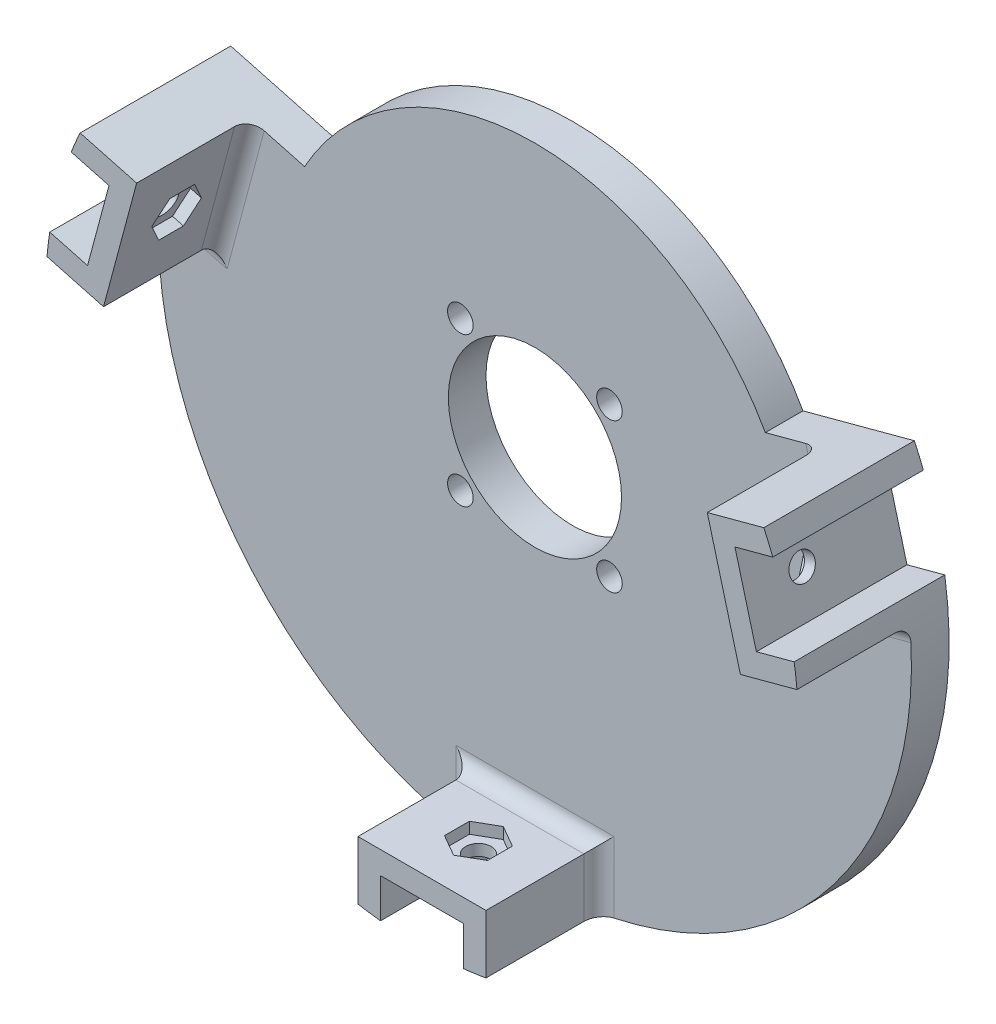
from build123d import *

# Parameters (mm, degrees)
CUT_EXTRUDE_1_DEPTH         = 1013.4351831105043
EXTRUDE_START               = 14.999999999999998
EXTRUDE_1_DEPTH             = 14.999999999999998
CUT_EXTRUDE_2_DEPTH         = 1008.5341185289956
EXTRUDE_2_DEPTH             = 14.999999999999998
CUT_EXTRUDE_3_DEPTH         = 1008.5341185289956
EXTRUDE_3_DEPTH             = 14.999999999999998
CUT_EXTRUDE_4_DEPTH         = 1008.5341185289956
CUT_EXTRUDE_5_DEPTH         = 1.5000000000000013
CUT_EXTRUDE_6_DEPTH         = 1.500000000000375
CUT_EXTRUDE_7_DEPTH         = 1.500000000000482
HOLE_WIZARD_23_0_23_1_D     = 23
HOLE_WIZARD_23_0_23_1_DEPTH = 20
HOLE_WIZARD_3_4_3_4_1_D     = 3.4
HOLE_WIZARD_3_4_3_4_1_DEPTH = 20
HOLE_WIZARD_3_4_3_4_2_D     = 3.4
HOLE_WIZARD_3_4_3_4_2_DEPTH = 6.696579359
HOLE_WIZARD_3_4_3_4_3_D     = 3.4
HOLE_WIZARD_3_4_3_4_3_DEPTH = 14.354957893
HOLE_WIZARD_3_4_3_4_4_D     = 3.4
HOLE_WIZARD_3_4_3_4_4_DEPTH = 14.354957893
FILLET_1_R                  = 2


with BuildPart() as part:
    # 草图1 → 旋转1 (revolve)
    with BuildSketch(Plane.XZ.offset(-300), mode=Mode.PRIVATE) as revolve_1_sk:
        Polygon((950.0000000000001, 5), (900, 4.999999999999999), (900, 0), (950.0000000000001, 0), align=None)
    revolve(revolve_1_sk.sketch.rotate(Axis((900, 300, 4.999999999999999), (0, 0, -1)), 180), axis=Axis((900, 300, 4.999999999999999), (0, 0, -1)))

    # 草图2 → 切除-拉伸1 (cut, through all)
    with BuildSketch(Plane.XY.offset(4.999999999999999)):
        with BuildLine():
            Line((854.6066683745289, 320.9629540842885), (869.404681855504, 316.99783832247647))
            ThreePointArc((869.404681855504, 316.99783832247647), (900, 334.99999999999966), (930.5953181444959, 316.99783832247647))
            Line((930.5953181444959, 316.99783832247647), (945.393331625471, 320.9629540842885))
            ThreePointArc((945.393331625471, 320.9629540842885), (900, 349.9999999999997), (854.6066683745289, 320.9629540842885))
        make_face()
    extrude(amount=-CUT_EXTRUDE_1_DEPTH, mode=Mode.SUBTRACT)

    # 草图3 → 凸台-拉伸1 (add)
    with BuildSketch(Plane.XY.offset(4.999999999999999).offset(EXTRUDE_START)):
        with BuildLine():
            Line((854.6066683745289, 320.9629540842885), (862.114040092375, 318.9513598952115))
            Line((862.114040092375, 318.9513598952115), (857.7141163256321, 302.5306208482976))
            Line((857.7141163256321, 302.5306208482976), (850.206744607786, 304.5422150373745))
            ThreePointArc((850.206744607786, 304.5422150373745), (851.7037086855465, 312.9409522551258), (854.6066683745289, 320.9629540842885))
        make_face()
    extrude(amount=-EXTRUDE_1_DEPTH)

    # 草图4 → 切除-拉伸2 (cut, through all)
    with BuildSketch(Plane.XY.offset(19.999999999999996)):
        with BuildLine():
            Line((850.573285770712, 307.549829170006), (855.592795982073, 306.204855462472))
            Line((855.592795982073, 306.204855462472), (858.4398054782009, 316.830039551652))
            Line((858.4398054782009, 316.830039551652), (853.4202952668401, 318.175013259186))
            ThreePointArc((853.4202952668401, 318.175013259186), (851.7037086855471, 312.9409522551259), (850.573285770712, 307.549829170006))
        make_face()
    extrude(amount=-CUT_EXTRUDE_2_DEPTH, mode=Mode.SUBTRACT)

    # 草图5 → 凸台-拉伸2 (add)
    with BuildSketch(Plane.XY.offset(4.999999999999999).offset(EXTRUDE_START)):
        with BuildLine():
            Line((891.5, 250.7277968830295), (891.5, 258.5))
            Line((891.5, 258.5), (908.5, 258.5))
            Line((908.5, 258.5), (908.5, 250.7277968830295))
            ThreePointArc((908.5, 250.7277968830295), (900, 250.00000000000003), (891.5, 250.7277968830295))
        make_face()
    extrude(amount=-EXTRUDE_2_DEPTH)

    # 草图6 → 切除-拉伸3 (cut, through all)
    with BuildSketch(Plane.XY.offset(19.999999999999996)):
        with BuildLine():
            Line((905.5, 250.30342064085298), (905.5, 255.5))
            Line((905.5, 255.5), (894.5, 255.5))
            Line((894.5, 255.5), (894.5, 250.30342064085298))
            ThreePointArc((894.5, 250.30342064085298), (900, 250.00000000000003), (905.5, 250.30342064085298))
        make_face()
    extrude(amount=-CUT_EXTRUDE_3_DEPTH, mode=Mode.SUBTRACT)

    # 草图7 → 凸台-拉伸3 (add)
    with BuildSketch(Plane.XY.offset(4.999999999999999).offset(EXTRUDE_START)):
        with BuildLine():
            Line((949.7932553922141, 304.5422150373745), (942.285883674368, 302.5306208482975))
            Line((942.285883674368, 302.5306208482975), (937.885959907625, 318.9513598952115))
            Line((937.885959907625, 318.9513598952115), (945.393331625471, 320.9629540842885))
            ThreePointArc((945.393331625471, 320.9629540842885), (948.2962913144532, 312.94095225512575), (949.7932553922141, 304.5422150373745))
        make_face()
    extrude(amount=-EXTRUDE_3_DEPTH)

    # 草图8 → 切除-拉伸4 (cut, through all)
    with BuildSketch(Plane.XY.offset(19.999999999999996)):
        with BuildLine():
            Line((946.5797047331605, 318.17501325918545), (941.5601945218003, 316.83003955165213))
            Line((941.5601945218003, 316.83003955165213), (944.4072040179273, 306.20485546247204))
            Line((944.4072040179273, 306.20485546247204), (949.4267142292881, 307.5498291700056))
            ThreePointArc((949.4267142292881, 307.5498291700056), (948.2962913144534, 312.94095225512547), (946.5797047331605, 318.17501325918545))
        make_face()
    extrude(amount=-CUT_EXTRUDE_4_DEPTH, mode=Mode.SUBTRACT)

    # 草图9 → 切除-拉伸5 (cut)
    with BuildSketch(Plane(origin=(0, 258.5, 0), x_dir=(-1, 0, 0), z_dir=(0, 1, 0))):
        Polygon((-902.857883832489, 14.149999999999999), (-902.857883832489, 10.85), (-900, 9.2), (-897.1421161675111, 10.85), (-897.1421161675121, 14.149999999999999), (-900, 15.8), align=None)
    extrude(amount=-CUT_EXTRUDE_5_DEPTH, mode=Mode.SUBTRACT)

    # 草图10 → 切除-拉伸6 (cut)
    with BuildSketch(Plane(origin=(724.6255099119961, -194.16282019591551, 0), x_dir=(0, 0, -1), z_dir=(0.9659258262890664, -0.25881904510252784, 0))):
        Polygon((-14.149999999999999, 519.8570046465061), (-10.85, 519.8570046465061), (-9.2, 522.7148884789947), (-10.85, 525.5727723114834), (-14.149999999999999, 525.5727723114834), (-15.8, 522.7148884789947), align=None)
    extrude(amount=-CUT_EXTRUDE_6_DEPTH, mode=Mode.SUBTRACT)

    # 草图11 → 切除-拉伸7 (cut)
    with BuildSketch(Plane(origin=(954.7973534939916, 255.83717980410037, 0), x_dir=(0, 0, 1), z_dir=(-0.9659258262890652, -0.2588190451025323, 0))):
        Polygon((10.85, 59.69849112692882), (9.2, 56.8406072944401), (10.85, 53.98272346195163), (14.149999999999999, 53.98272346195163), (15.8, 56.8406072944401), (14.149999999999999, 59.69849112692882), align=None)
    extrude(amount=-CUT_EXTRUDE_7_DEPTH, mode=Mode.SUBTRACT)

    # Ø23.0 (23) 直径孔1
    with Locations(Plane(origin=(0, 0, 0), x_dir=(-1, 0, 0), z_dir=(0, 0, -1))):
        with Locations((-900, 300)):
            Hole(HOLE_WIZARD_23_0_23_1_D / 2, depth=HOLE_WIZARD_23_0_23_1_DEPTH)

    # Ø3.4 (3.4) 直径孔1
    with Locations(Plane(origin=(0, 0, 0), x_dir=(-1, 0, 0), z_dir=(0, 0, -1))):
        with Locations((-909.899494937, 290.100505063), (-909.899494937, 309.899494937), (-890.100505063, 309.899494937), (-890.100505063, 290.100505063)):
            Hole(HOLE_WIZARD_3_4_3_4_1_D / 2, depth=HOLE_WIZARD_3_4_3_4_1_DEPTH)

    # Ø3.4 (3.4) 直径孔2
    with Locations(Plane(origin=(0, 257, 0), x_dir=(1, 0, 0), z_dir=(0, 1, 0))):
        with Locations((900, -12.5)):
            Hole(HOLE_WIZARD_3_4_3_4_2_D / 2, depth=HOLE_WIZARD_3_4_3_4_2_DEPTH)

    # Ø3.4 (3.4) 直径孔3
    with Locations(Plane(origin=(723.1766211725698, -193.77459162825534, 0), x_dir=(0, 0, -1), z_dir=(0.9659258262890692, -0.2588190451025174, 0))):
        with Locations((-12.5, 522.714888479)):
            Hole(HOLE_WIZARD_3_4_3_4_3_D / 2, depth=HOLE_WIZARD_3_4_3_4_3_DEPTH)

    # Ø3.4 (3.4) 直径孔4
    with Locations(Plane(origin=(956.2462422334311, 256.22540837172977, 0), x_dir=(0, 0, 1), z_dir=(-0.9659258262890719, -0.25881904510250775, 0))):
        with Locations((12.5, 56.840607294)):
            Hole(HOLE_WIZARD_3_4_3_4_4_D / 2, depth=HOLE_WIZARD_3_4_3_4_4_DEPTH)

    # 圆角1
    fillet_1_edges = [part.edges().sort_by_distance(p)[0] for p in [
        (853.9604304667091, 303.536417942836, 4.999999999999999),
        (859.9140782090035, 310.74099037175455, 4.999999999999999),
        (908.5, 254.61389844151475, 4.999999999999999),
        (900, 258.5, 4.999999999999999),
        (891.5, 254.61389844151475, 4.999999999999999),
        (940.0859217909965, 310.7409903717545, 4.999999999999999),
        (946.0395695332911, 303.536417942836, 4.999999999999999),
    ]]
    fillet(fillet_1_edges, radius=FILLET_1_R)


solid = part.part
